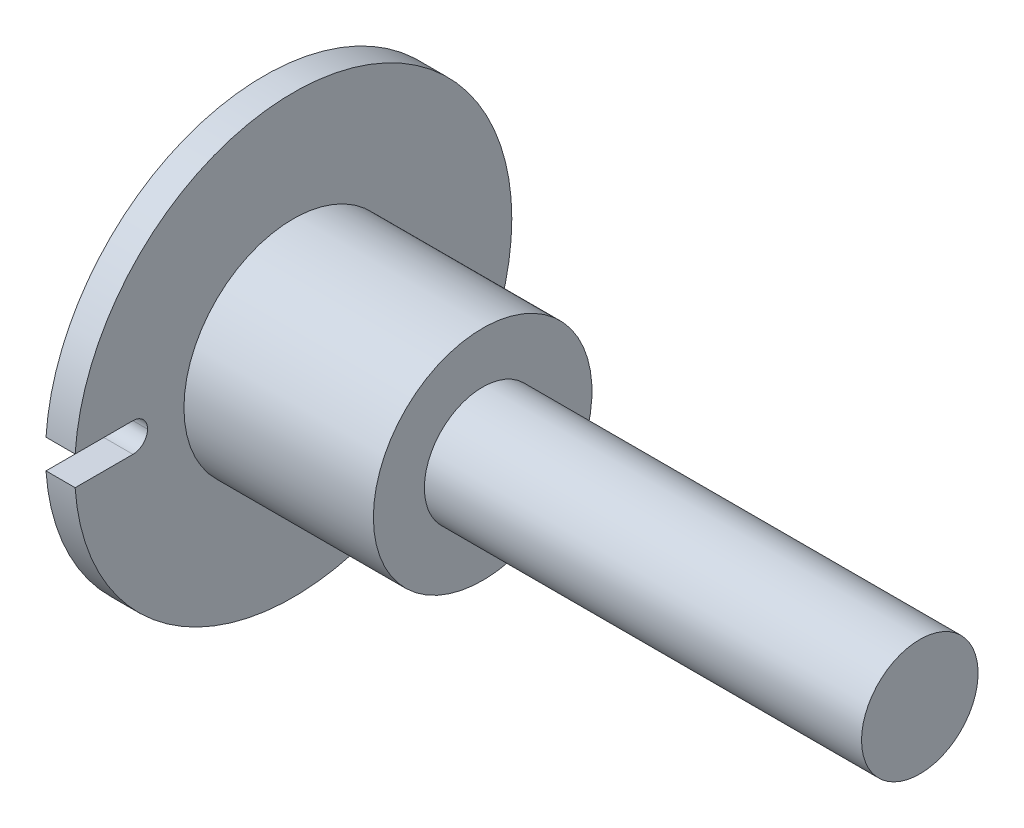
from build123d import *

# Parameters (mm, degrees)
SCHNITT_LINEAR_AUSTRAGEN1_DEPTH      = 50.749371855
SCHNITT_LINEAR_AUSTRAGEN1_DEPTH_BACK = 50.749371855
SKIZZE3_W                            = 6
SKIZZE3_H                            = 0.5
M4_GEWINDEBOHRUNG2_D                 = 3.3
M4_GEWINDEBOHRUNG2_DEPTH             = 8.5
M4_GEWINDEBOHRUNG2_TIP               = 0.991420021
SKIZZE10_W                           = 5.838792557
SKIZZE10_H                           = 2
SCHNITT_LINEAR_AUSTRAGEN2_DEPTH      = 2
VERRUNDUNG1_R                        = 1


with BuildPart() as part:
    # Skizze1 → Rotation1 (revolve)
    with BuildSketch(Plane.XY, mode=Mode.PRIVATE) as rotation1_sk:
        Polygon((0, 3.2), (10, 3.2), (11.922753981, 0), (45, 0), (45, 4), (15, 4), (15, 7.5), (2, 7.5), (2, 15), (0, 15), (0, 7.5), align=None)
    revolve(rotation1_sk.sketch.rotate(Axis((0, 0, 0), (1, 0, 0)), 90), axis=Axis((0, 0, 0), (1, 0, 0)))

    # Skizze3 → Schnitt-Linear austragen1 (cut, two sides: drawn at the far end of the back side and taken through both)
    with BuildSketch(Plane(origin=(0, 0, 0), x_dir=(1, 0, 0), z_dir=(0, 1, 0)).offset(-SCHNITT_LINEAR_AUSTRAGEN1_DEPTH_BACK)):
        with Locations((32, 3.75)):
            Rectangle(SKIZZE3_W, SKIZZE3_H)
    extrude(amount=SCHNITT_LINEAR_AUSTRAGEN1_DEPTH + SCHNITT_LINEAR_AUSTRAGEN1_DEPTH_BACK, mode=Mode.SUBTRACT)

    # M4 Gewindebohrung2
    with Locations(Plane(origin=(0, 0, -7.5), x_dir=(1, 0, 0), z_dir=(0, 0, -1))):
        with Locations((5, 0)):
            Hole(M4_GEWINDEBOHRUNG2_D / 2, depth=M4_GEWINDEBOHRUNG2_DEPTH)
            with Locations((0, 0, -(M4_GEWINDEBOHRUNG2_DEPTH + M4_GEWINDEBOHRUNG2_TIP / 2))):  # 118° drill point
                Cone(0, M4_GEWINDEBOHRUNG2_D / 2, M4_GEWINDEBOHRUNG2_TIP, mode=Mode.SUBTRACT)

    # Skizze10 → Schnitt-Linear austragen2 (cut)
    with BuildSketch(Plane.ZY):
        with Locations((12.919396279, 0)):
            Rectangle(SKIZZE10_W, SKIZZE10_H)
    extrude(amount=-SCHNITT_LINEAR_AUSTRAGEN2_DEPTH, mode=Mode.SUBTRACT)

    # Verrundung1
    verrundung1_edges = [part.edges().sort_by_distance(p)[0] for p in [
        (1, -1, 10),
        (1, 1, 10),
    ]]
    fillet(verrundung1_edges, radius=VERRUNDUNG1_R - 0.0001)  # a hair under: the kernel refuses the full size


solid = part.part
